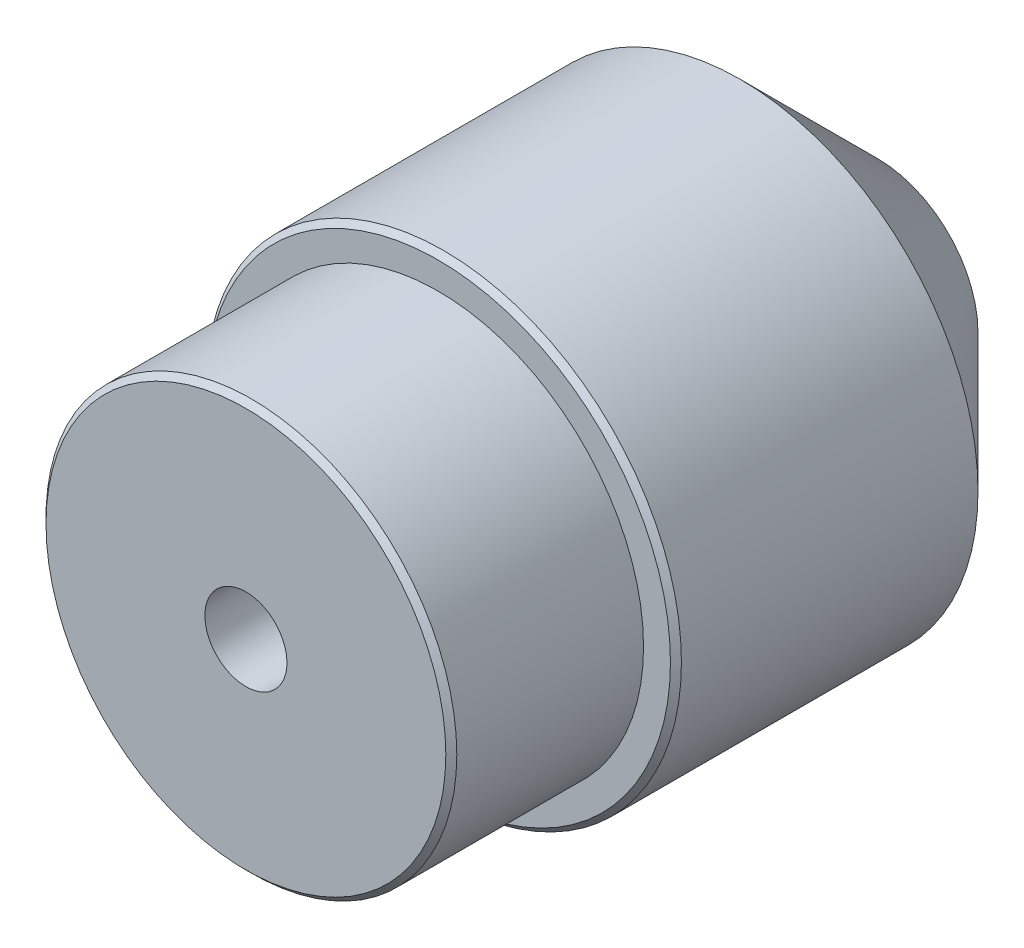
from build123d import *

# Parameters (mm, degrees)
SKETCH1_R                    = 10.9982
BOSS_EXTRUDE1_DEPTH          = 20.32
SKETCH2_R                    = 9.4996
BOSS_EXTRUDE2_DEPTH          = 8.89
B_0_238_DIAMETER_HOLE1_D     = 6.0452
B_0_238_DIAMETER_HOLE1_DEPTH = 19.05
B_0_238_DIAMETER_HOLE1_TIP   = 1.816161307
BOSS_EXTRUDE5_START          = -9.484662807
BOSS_EXTRUDE5_OUTLINE_R      = 1.89865
BOSS_EXTRUDE5_DEPTH          = 9.484662807
SKETCH11_R                   = 1.89865
CUT_EXTRUDE1_DEPTH           = 34.092973672
SKETCH12_R                   = 1.89865
CUT_EXTRUDE2_DEPTH           = 34.092973739
CHAMFER1_SIZE                = 6.35
CHAMFER2_SIZE                = 0.254
CHAMFER3_SIZE                = 0.254


# Read off the part's stored shape, not the designer's step: Boss-Extrude5
with BuildPart() as part:
    # Sketch1 → Boss-Extrude1 (new body)
    with BuildSketch(Plane.XY):
        Circle(SKETCH1_R)
    extrude(amount=BOSS_EXTRUDE1_DEPTH)

    # Sketch2 → Boss-Extrude2 (add)
    with BuildSketch(Plane.XY.offset(20.32)):
        Circle(SKETCH2_R)
    extrude(amount=BOSS_EXTRUDE2_DEPTH)

    # B (0.238) Diameter Hole1
    with Locations(Plane(origin=(0, 0, 0), x_dir=(-1, 0, 0), z_dir=(0, 0, -1))):
        with Locations((0, 0)):
            Hole(B_0_238_DIAMETER_HOLE1_D / 2, depth=B_0_238_DIAMETER_HOLE1_DEPTH)
            with Locations((0, 0, -(B_0_238_DIAMETER_HOLE1_DEPTH + B_0_238_DIAMETER_HOLE1_TIP / 2))):  # 118° drill point
                Cone(0, B_0_238_DIAMETER_HOLE1_D / 2, B_0_238_DIAMETER_HOLE1_TIP, mode=Mode.SUBTRACT)

    # Boss-Extrude5 outline → Boss-Extrude5 (cut)
    with BuildSketch(Plane.XY.offset(29.21).offset(BOSS_EXTRUDE5_START)):
        Circle(BOSS_EXTRUDE5_OUTLINE_R)
    extrude(amount=BOSS_EXTRUDE5_DEPTH, mode=Mode.SUBTRACT)

    # Sketch11 → Cut-Extrude1 (cut, through all)
    with BuildSketch(Plane(origin=(0, 0, 0), x_dir=(1, 0, 0), z_dir=(0, 1, 0))):
        with Locations(Location((0, -9.525, 0), (0, 0, 270))):
            Circle(SKETCH11_R)
    extrude(amount=-CUT_EXTRUDE1_DEPTH, mode=Mode.SUBTRACT)

    # Sketch12 → Cut-Extrude2 (cut, through all)
    with BuildSketch(Plane(origin=(0, 0, 0), x_dir=(0, 0, -1), z_dir=(1, 0, 0))):
        with Locations((-9.525, 0)):
            Circle(SKETCH12_R)
    extrude(amount=-CUT_EXTRUDE2_DEPTH, mode=Mode.SUBTRACT)

    # Chamfer1
    chamfer1_edges = [part.edges().sort_by_distance(p)[0] for p in [
        (-10.9982, 0, 0),
    ]]
    chamfer(chamfer1_edges, length=CHAMFER1_SIZE)

    # Chamfer2
    chamfer2_edges = [part.edges().sort_by_distance(p)[0] for p in [
        (-10.9982, 0, 20.32),
    ]]
    chamfer(chamfer2_edges, length=CHAMFER2_SIZE)

    # Chamfer3
    chamfer3_edges = [part.edges().sort_by_distance(p)[0] for p in [
        (-9.4996, 0, 29.21),
    ]]
    chamfer(chamfer3_edges, length=CHAMFER3_SIZE)


solid = part.part
